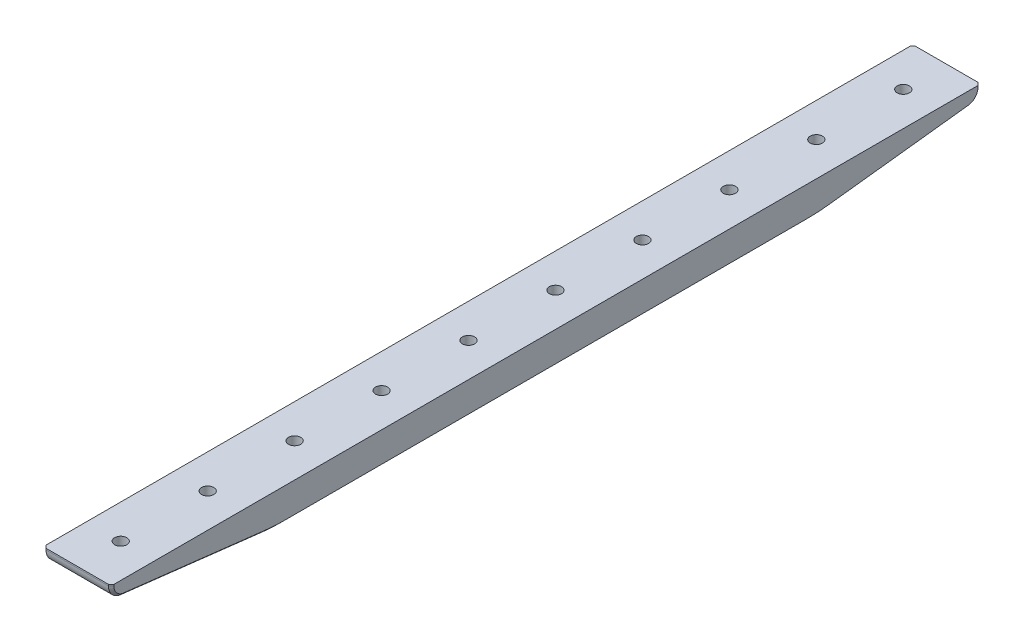
from build123d import *

# Parameters (mm, degrees)
BOSS_EXTRUDE1_DEPTH = 25
FILLET1_R           = 70
FILLET2_R           = 5
CHAMFER1_SIZE       = 1
SKETCH2_R           = 2.25
CUT_EXTRUDE1_DEPTH  = 163.385344166
SKETCH5_W           = 8
SKETCH5_H           = 7
CUT_EXTRUDE2_DEPTH  = 322.199315068
CHAMFER2_SIZE       = 1


with BuildPart() as part:
    # Sketch1 → Boss-Extrude1 (new body)
    with BuildSketch(Plane(origin=(0, 0, 0), x_dir=(0, 0, -1), z_dir=(1, 0, 0))):
        Polygon((-160, 0), (160, 0), (160, -5), (100, -12), (-100, -12), (-160, -5), align=None)
    extrude(amount=BOSS_EXTRUDE1_DEPTH)

    # Fillet1
    fillet1_edges = [part.edges().sort_by_distance(p)[0] for p in [
        (12.5, -12, -100),
        (12.5, -12, 100),
    ]]
    fillet(fillet1_edges, radius=FILLET1_R)

    # Fillet2
    fillet2_edges = [part.edges().sort_by_distance(p)[0] for p in [
        (12.5, -5, -160),
        (12.5, -5, 160),
    ]]
    fillet(fillet2_edges, radius=FILLET2_R)

    # Chamfer1
    chamfer1_edges = [part.edges().sort_by_distance(p)[0] for p in [
        (25, -0.274710282, 160),
        (0, -8.522077997, -129.810760023),
        (25, -8.522077997, -129.810760023),
        (0, -12, 0),
        (0, -11.882005486, 99.99314025),
        (0, -11.882005486, -99.99314025),
        (25, -12, 0),
        (25, -11.882005486, 99.99314025),
        (25, -11.882005486, -99.99314025),
        (0, -0.274710282, -160),
        (25, -0.274710282, -160),
        (0, -8.522077997, 129.810760023),
        (0, -3.873798889, 158.73477024),
        (0, -3.873798889, -158.73477024),
        (25, -8.522077997, 129.810760023),
        (25, -3.873798889, 158.73477024),
        (25, -3.873798889, -158.73477024),
        (0, -0.274710282, 160),
    ]]
    chamfer(chamfer1_edges, length=CHAMFER1_SIZE)

    # Sketch2 → Cut-Extrude1 (cut, through all)
    with BuildSketch(Plane.XZ.offset(12)):
        with Locations(Location((12.5, 144, 0), (0, 0, 270))):
            Circle(SKETCH2_R)
        with Locations(Location((12.5, 112, 0), (0, 0, 270))):
            Circle(SKETCH2_R)
        with Locations(Location((12.5, 48, 0), (0, 0, 270))):
            Circle(SKETCH2_R)
        with Locations(Location((12.5, 80, 0), (0, 0, 270))):
            Circle(SKETCH2_R)
        with Locations(Location((12.5, -80, 0), (0, 0, 90))):
            Circle(SKETCH2_R)
        with Locations(Location((12.5, -48, 0), (0, 0, 90))):
            Circle(SKETCH2_R)
        with Locations(Location((12.5, -112, 0), (0, 0, 90))):
            Circle(SKETCH2_R)
        with Locations(Location((12.5, -144, 0), (0, 0, 90))):
            Circle(SKETCH2_R)
        with Locations(Location((12.5, 16, 0), (0, 0, 270))):
            Circle(SKETCH2_R)
        with Locations(Location((12.5, -16, 0), (0, 0, 90))):
            Circle(SKETCH2_R)
    extrude(amount=-CUT_EXTRUDE1_DEPTH, mode=Mode.SUBTRACT)

    # Sketch5 → Cut-Extrude2 (cut, through all)
    with BuildSketch(Plane.XY.offset(160)):
        with Locations((12.5, -8.5)):
            Rectangle(SKETCH5_W, SKETCH5_H)
    extrude(amount=-CUT_EXTRUDE2_DEPTH, mode=Mode.SUBTRACT)

    # Chamfer2
    # the kernel refuses this chamfer: 1 mm, written as the material it takes off along each edge
    with BuildSketch(Plane(origin=(16.5, -0.549420563, 155), x_dir=(0, -0.5507413136369002, 0.8346759883053434), z_dir=(0, 0.8346759883053434, 0.5507413136369002))) as chamfer2_piece_1_section:
        Polygon((5, CHAMFER2_SIZE), (5 - CHAMFER2_SIZE, 0), (5, 0), align=None)
    chamfer2_piece_1 = revolve(axis=Axis((16.5, -0.549420563, 155), (1, 0, 0)), revolution_arc=49.927689897, mode=Mode.PRIVATE)
    chamfer2_piece_1 = split(chamfer2_piece_1, bisect_by=Plane(origin=(16.914516826, -5, 156.211106637), z_dir=(0, -1, 0)), keep=Keep.TOP, mode=Mode.PRIVATE)
    add(chamfer2_piece_1, mode=Mode.SUBTRACT)
    with BuildSketch(Plane(origin=(8.5, -0.549420563, 155), x_dir=(0, -0.5507413136369004, 0.8346759883053431), z_dir=(0, 0.8346759883053431, 0.5507413136369004))) as chamfer2_piece_2_section:
        Polygon((5 - CHAMFER2_SIZE, 0), (5, -CHAMFER2_SIZE), (5, 0), align=None)
    chamfer2_piece_2 = revolve(axis=Axis((8.5, -0.549420563, 155), (1, 0, 0)), revolution_arc=49.927689897, mode=Mode.PRIVATE)
    chamfer2_piece_2 = split(chamfer2_piece_2, bisect_by=Plane(origin=(8.085483174, -5, 156.211106637), z_dir=(0, -1, 0)), keep=Keep.TOP, mode=Mode.PRIVATE)
    add(chamfer2_piece_2, mode=Mode.SUBTRACT)
    with BuildSketch(Plane(origin=(8.5, 58, -95.930467578), x_dir=(0, -1, 0), z_dir=(0, 0, 1))) as chamfer2_piece_3:
        Polygon((70, -CHAMFER2_SIZE), (70 - CHAMFER2_SIZE, 0), (70, 0), align=None)
    revolve(axis=Axis((8.5, 58, -95.930467578), (1, 0, 0)), revolution_arc=6.654425046, mode=Mode.SUBTRACT)
    with BuildSketch(Plane(origin=(8.5, -0.549420563, -155), x_dir=(0, -0.9932631390872432, -0.11588069956017648), z_dir=(0, -0.11588069956017648, 0.9932631390872432))) as chamfer2_piece_4_section:
        Polygon((5 - CHAMFER2_SIZE, 0), (5, -CHAMFER2_SIZE), (5, 0), align=None)
    chamfer2_piece_4 = revolve(axis=Axis((8.5, -0.549420563, -155), (1, 0, 0)), revolution_arc=49.927689897, mode=Mode.PRIVATE)
    chamfer2_piece_4 = split(chamfer2_piece_4, bisect_by=Plane(origin=(8.085483174, -5, -156.211106637), z_dir=(0, -1, 0)), keep=Keep.TOP, mode=Mode.PRIVATE)
    add(chamfer2_piece_4, mode=Mode.SUBTRACT)
    with BuildSketch(Plane(origin=(8.5, 58, 95.930467578), x_dir=(0, -0.9932631390872428, 0.11588069956017871), z_dir=(0, 0.11588069956017871, 0.9932631390872428))) as chamfer2_piece_5:
        Polygon((70 - CHAMFER2_SIZE, 0), (70, -CHAMFER2_SIZE), (70, 0), align=None)
    revolve(axis=Axis((8.5, 58, 95.930467578), (1, 0, 0)), revolution_arc=6.654425046, mode=Mode.SUBTRACT)
    with BuildSketch(Plane(origin=(16.5, 58, -95.930467578), x_dir=(0, -1, 0), z_dir=(0, 0, 1))) as chamfer2_piece_6:
        Polygon((70 - CHAMFER2_SIZE, 0), (70, CHAMFER2_SIZE), (70, 0), align=None)
    revolve(axis=Axis((16.5, 58, -95.930467578), (1, 0, 0)), revolution_arc=6.654425046, mode=Mode.SUBTRACT)
    with BuildSketch(Plane(origin=(16.5, -0.549420563, -155), x_dir=(0, -0.9932631390872432, -0.11588069956017648), z_dir=(0, -0.11588069956017648, 0.9932631390872432))) as chamfer2_piece_7_section:
        Polygon((5, CHAMFER2_SIZE), (5 - CHAMFER2_SIZE, 0), (5, 0), align=None)
    chamfer2_piece_7 = revolve(axis=Axis((16.5, -0.549420563, -155), (1, 0, 0)), revolution_arc=49.927689897, mode=Mode.PRIVATE)
    chamfer2_piece_7 = split(chamfer2_piece_7, bisect_by=Plane(origin=(16.914516826, -5, -156.211106637), z_dir=(0, -1, 0)), keep=Keep.TOP, mode=Mode.PRIVATE)
    add(chamfer2_piece_7, mode=Mode.SUBTRACT)
    with BuildSketch(Plane(origin=(16.5, 58, 95.930467578), x_dir=(0, -0.9932631390872428, 0.11588069956017871), z_dir=(0, 0.11588069956017871, 0.9932631390872428))) as chamfer2_piece_8:
        Polygon((70 - CHAMFER2_SIZE, 0), (70, CHAMFER2_SIZE), (70, 0), align=None)
    revolve(axis=Axis((16.5, 58, 95.930467578), (1, 0, 0)), revolution_arc=6.654425046, mode=Mode.SUBTRACT)
    with BuildSketch(Plane(origin=(16.5, -12, 95.930467578), x_dir=(-0.0274958766105891, 0.9996219169112968, 0), z_dir=(0, 0, -1))) as chamfer2_piece_9:
        Polygon((CHAMFER2_SIZE * 0.999621916911, CHAMFER2_SIZE * 0.0274958766106), (-CHAMFER2_SIZE * 0.0274958766106, CHAMFER2_SIZE * 0.999621916911), (0, 0), align=None)
    extrude(amount=191.860935157, mode=Mode.SUBTRACT)
    with BuildSketch(Plane(origin=(8.5, -12, 95.930467578), x_dir=(0.02749587661058392, 0.9996219169112968, 0), z_dir=(0, 0, -1))) as chamfer2_piece_10:
        Polygon((CHAMFER2_SIZE * 0.999621916911, -CHAMFER2_SIZE * 0.0274958766106), (-CHAMFER2_SIZE * 0.0274958766106, -CHAMFER2_SIZE * 0.999621916911), (0, 0), align=None)
    extrude(amount=191.860935157, mode=Mode.SUBTRACT)
    with BuildSketch(Plane(origin=(8.5, -5.515736259, 155.579403498), x_dir=(0.02749587661058567, 0.9928876030917217, -0.11583688702736752), z_dir=(0, -0.11588069956017834, -0.993263139087243))) as chamfer2_piece_11_section:
        Polygon((CHAMFER2_SIZE * 0.999621916911, -CHAMFER2_SIZE * 0.0274958766106), (-CHAMFER2_SIZE * 0.0274958766106, -CHAMFER2_SIZE * 0.999621916911), (0, 0), align=None)
    chamfer2_piece_11 = extrude(amount=51.886841384, mode=Mode.PRIVATE)
    chamfer2_piece_11 = split(chamfer2_piece_11, bisect_by=Plane(origin=(8.17503416, -5, 154.587318638), z_dir=(0, -1, 0)), keep=Keep.TOP, mode=Mode.PRIVATE)
    add(chamfer2_piece_11, mode=Mode.SUBTRACT)
    with BuildSketch(Plane(origin=(8.5, -11.528419736, -104.042116548), x_dir=(-0.9996219169112968, -0.027310640714189302, -0.0031862414166552175), z_dir=(0, 0.11588069956017857, -0.993263139087243))) as chamfer2_piece_12_section:
        Polygon((CHAMFER2_SIZE * 0.999621916911, CHAMFER2_SIZE * 0.0274958766106), (-CHAMFER2_SIZE * 0.0274958766106, CHAMFER2_SIZE * 0.999621916911), (0, 0), align=None)
    chamfer2_piece_12 = extrude(amount=51.886841384, mode=Mode.PRIVATE)
    chamfer2_piece_12 = split(chamfer2_piece_12, bisect_by=Plane(origin=(8.158054196, -5, -132.007867246), z_dir=(0, -1, 0)), keep=Keep.TOP, mode=Mode.PRIVATE)
    add(chamfer2_piece_12, mode=Mode.SUBTRACT)
    with BuildSketch(Plane(origin=(16.5, -5.515736259, -155.579403498), x_dir=(-0.027495876610589238, 0.9928876030917216, 0.11583688702736777), z_dir=(0, -0.11588069956017857, 0.993263139087243))) as chamfer2_piece_13_section:
        Polygon((CHAMFER2_SIZE * 0.999621916911, -CHAMFER2_SIZE * 0.0274958766106), (-CHAMFER2_SIZE * 0.0274958766106, -CHAMFER2_SIZE * 0.999621916911), (0, 0), align=None)
    chamfer2_piece_13 = extrude(amount=51.886841384, mode=Mode.PRIVATE)
    chamfer2_piece_13 = split(chamfer2_piece_13, bisect_by=Plane(origin=(16.82496584, -5, -154.587318638), z_dir=(0, -1, 0)), keep=Keep.TOP, mode=Mode.PRIVATE)
    add(chamfer2_piece_13, mode=Mode.SUBTRACT)
    with BuildSketch(Plane(origin=(16.5, -11.528419736, 104.042116548), x_dir=(-0.02749587661058908, 0.9928876030917217, -0.11583688702736755), z_dir=(0, 0.11588069956017834, 0.993263139087243))) as chamfer2_piece_14_section:
        Polygon((CHAMFER2_SIZE * 0.999621916911, -CHAMFER2_SIZE * 0.0274958766106), (-CHAMFER2_SIZE * 0.0274958766106, -CHAMFER2_SIZE * 0.999621916911), (0, 0), align=None)
    chamfer2_piece_14 = extrude(amount=51.886841384, mode=Mode.PRIVATE)
    chamfer2_piece_14 = split(chamfer2_piece_14, bisect_by=Plane(origin=(16.785811772, -5, 107.657614918), z_dir=(0, -1, 0)), keep=Keep.TOP, mode=Mode.PRIVATE)
    add(chamfer2_piece_14, mode=Mode.SUBTRACT)


solid = part.part
